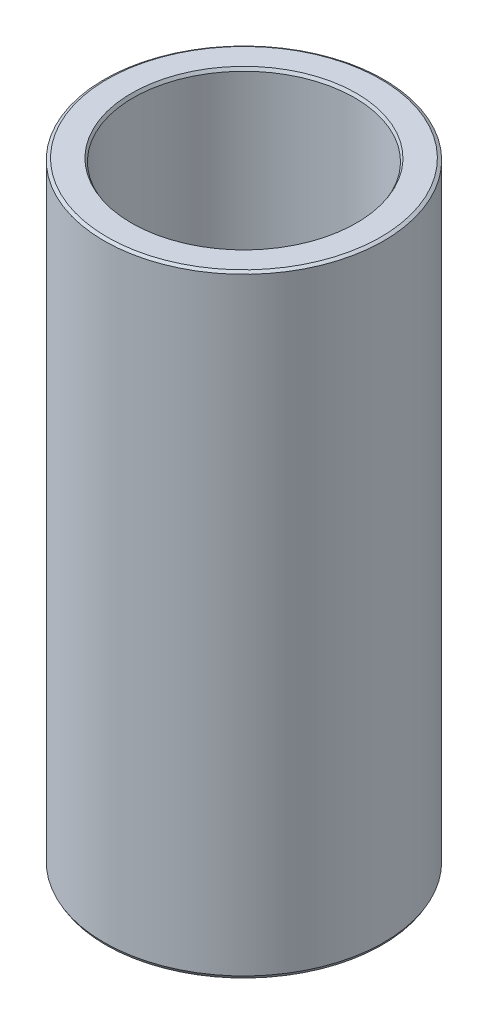
from build123d import *
from OCP.BRepFilletAPI import BRepFilletAPI_MakeChamfer

# Parameters (mm, degrees)
SKETCH1_R           = 50
BOSS_EXTRUDE1_DEPTH = 219.004814429
SKETCH2_R           = 39.593619981
CUT_EXTRUDE1_DEPTH  = 231.137152027
CHAMFER1_SIZE       = 0.625283287
CHAMFER1_SIZE2      = 1.083022422


with BuildPart() as part:
    # Sketch1 → Boss-Extrude1 (new body)
    with BuildSketch(Plane(origin=(0, 0, 0), x_dir=(1, 0, 0), z_dir=(0, 1, 0))):
        Circle(SKETCH1_R)
    extrude(amount=BOSS_EXTRUDE1_DEPTH)

    # Sketch2 → Cut-Extrude1 (cut, through all)
    with BuildSketch(Plane(origin=(0, 0, 0), x_dir=(1, 0, 0), z_dir=(0, 1, 0))):
        Circle(SKETCH2_R)
    extrude(amount=CUT_EXTRUDE1_DEPTH, mode=Mode.SUBTRACT)

    # Chamfer1: one chamfer whose edges measure the first distance from different faces: ONE call of the kernel's chamfer builder (chamfer() names one face for all edges)
    chamfer1_edges_1 = [part.edges().sort_by_distance(p)[0] for p in [
        (-39.593619981, 219.004814429, 0),
    ]]
    chamfer1_side_1 = [part.faces().sort_by_distance(p)[0] for p in [
        (-48.585786438, 219.004814429, 0),
    ]]
    chamfer1_edges_2 = [part.edges().sort_by_distance(p)[0] for p in [
        (-39.593619981, 0, 0),
    ]]
    chamfer1_side_2 = [part.faces().sort_by_distance(p)[0] for p in [
        (-39.593619981, 109.502407215, 0),
    ]]
    chamfer1_edges_3 = [part.edges().sort_by_distance(p)[0] for p in [
        (-50, 0, 0),
    ]]
    chamfer1_side_3 = [part.faces().sort_by_distance(p)[0] for p in [
        (-48.585786438, 0, 0),
    ]]
    chamfer1_edges_4 = [part.edges().sort_by_distance(p)[0] for p in [
        (-50, 219.004814429, 0),
    ]]
    chamfer1_side_4 = [part.faces().sort_by_distance(p)[0] for p in [
        (-50, 109.502407215, 0),
    ]]
    chamfer1 = BRepFilletAPI_MakeChamfer(part.part.solid().wrapped)
    for e in chamfer1_edges_1:
        chamfer1.Add(CHAMFER1_SIZE, CHAMFER1_SIZE2, e.wrapped, chamfer1_side_1[0].wrapped)  # the first distance lies on this face
    for e in chamfer1_edges_2:
        chamfer1.Add(CHAMFER1_SIZE, CHAMFER1_SIZE2, e.wrapped, chamfer1_side_2[0].wrapped)  # the first distance lies on this face
    for e in chamfer1_edges_3:
        chamfer1.Add(CHAMFER1_SIZE, CHAMFER1_SIZE2, e.wrapped, chamfer1_side_3[0].wrapped)  # the first distance lies on this face
    for e in chamfer1_edges_4:
        chamfer1.Add(CHAMFER1_SIZE, CHAMFER1_SIZE2, e.wrapped, chamfer1_side_4[0].wrapped)  # the first distance lies on this face
    add(Compound.cast(chamfer1.Shape()), mode=Mode.REPLACE)


solid = part.part
